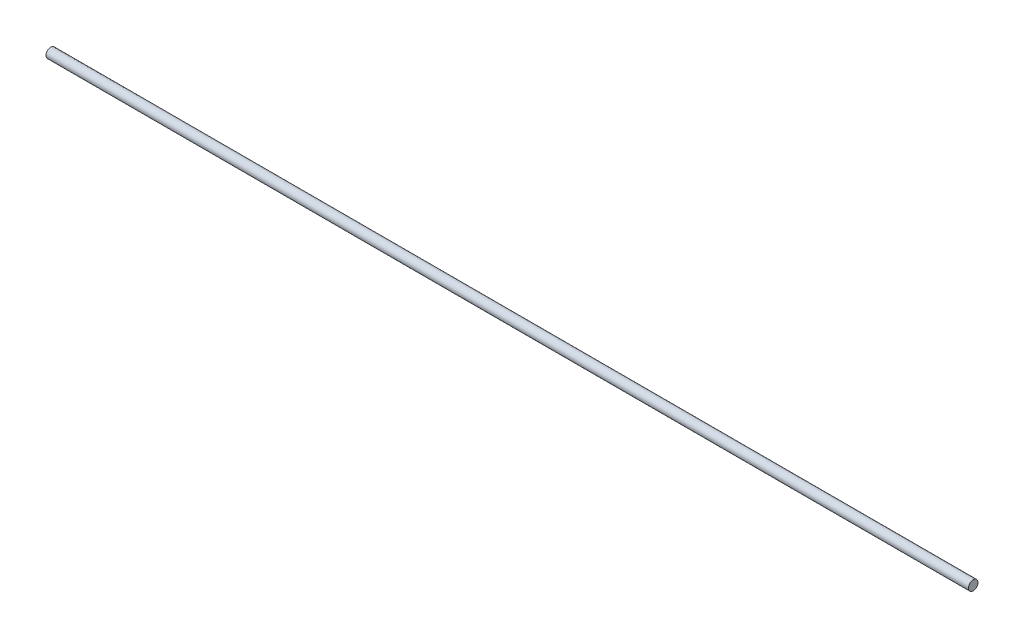
from build123d import *

# Parameters (mm, degrees)
SKETCH1_R           = 9.525
BOSS_EXTRUDE1_DEPTH = 1828.8


with BuildPart() as part:
    # Sketch1 → Boss-Extrude1 (new body)
    with BuildSketch(Plane(origin=(0, 0, 0), x_dir=(0, 0, -1), z_dir=(1, 0, 0))):
        Circle(SKETCH1_R)
    extrude(amount=BOSS_EXTRUDE1_DEPTH)


solid = part.part
